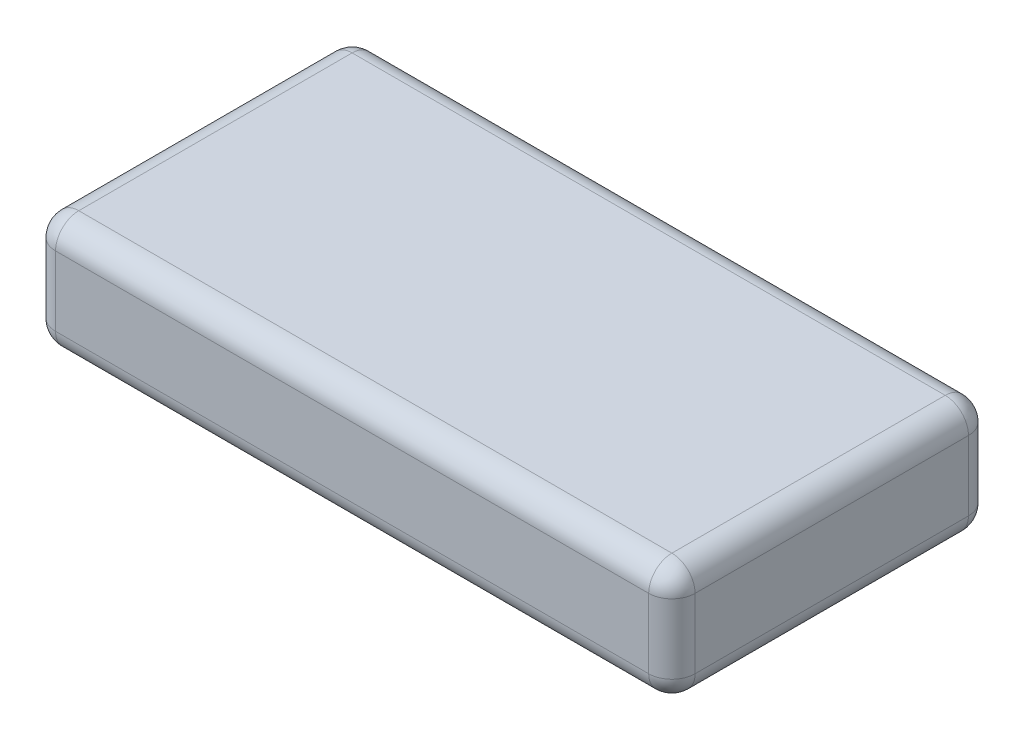
from build123d import *

# Parameters (mm, degrees)
SKETCH1_W           = 70
SKETCH1_H           = 35
BOSS_EXTRUDE1_DEPTH = 12.7
FILLET1_R           = 2.54


with BuildPart() as part:
    # Sketch1 → Boss-Extrude1 (new body)
    with BuildSketch(Plane(origin=(0, 0, 0), x_dir=(1, 0, 0), z_dir=(0, 1, 0))):
        with Locations((8.324917755, 5.659761329)):
            Rectangle(SKETCH1_W, SKETCH1_H)
    extrude(amount=BOSS_EXTRUDE1_DEPTH)

    # Fillet1
    fillet1_edges = [part.edges().sort_by_distance(p)[0] for p in [
        (43.324917755, 6.35, 11.840238671),
        (8.324917755, 0, 11.840238671),
        (43.324917755, 0, -5.659761329),
        (-26.675082245, 6.35, 11.840238671),
        (-26.675082245, 0, -5.659761329),
        (43.324917755, 6.35, -23.159761329),
        (-26.675082245, 6.35, -23.159761329),
        (8.324917755, 0, -23.159761329),
        (8.324917755, 12.7, -23.159761329),
        (43.324917755, 12.7, -5.659761329),
        (8.324917755, 12.7, 11.840238671),
        (-26.675082245, 12.7, -5.659761329),
    ]]
    fillet(fillet1_edges, radius=FILLET1_R)


solid = part.part
